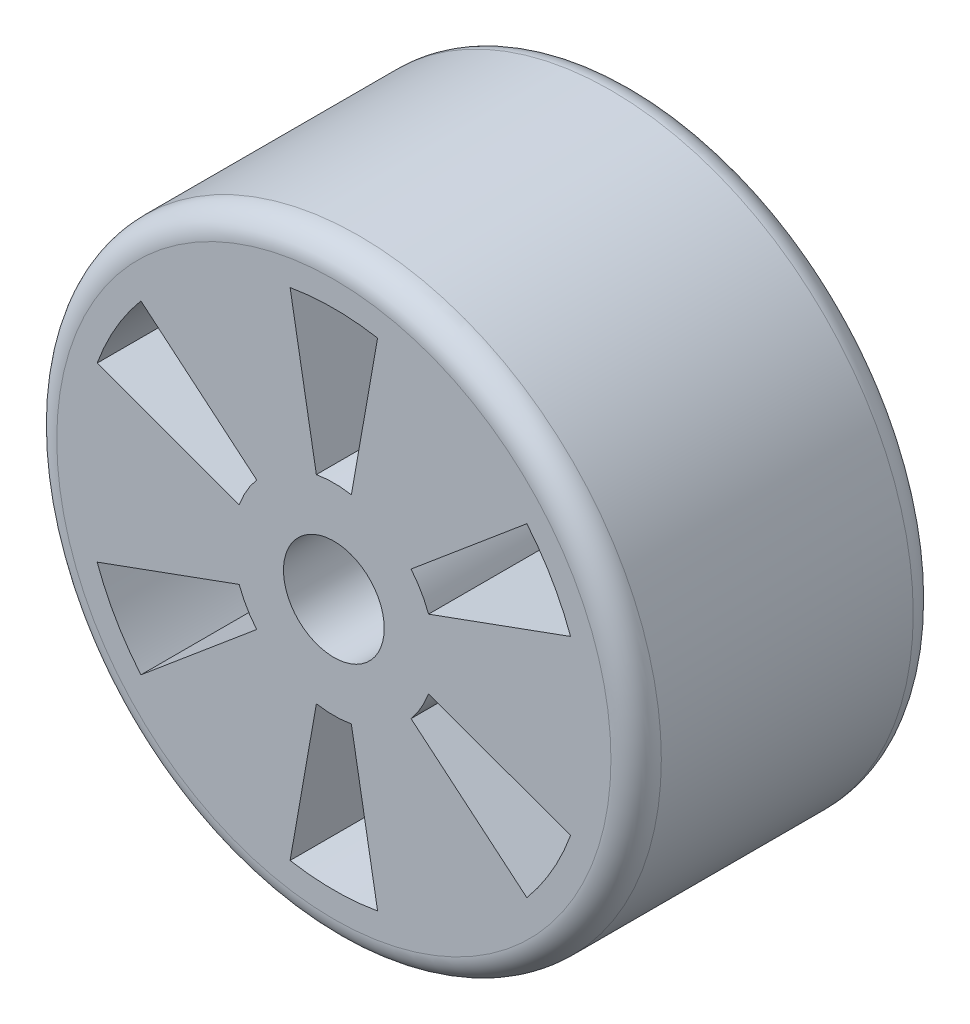
from build123d import *

# Parameters (mm, degrees)
SKETCH_1_R               = 60
SKETCH_1_R_2             = 10
EXTRUDE_1_DEPTH          = 60
CUT_EXTRUDE_1_DEPTH      = 60
PATTERN_CIRCULAR_1_COUNT = 6
FILLET_1_R               = 5


with BuildPart() as part:
    # 草图1 → 凸台-拉伸1 (new body)
    with BuildSketch(Plane.XY):
        Circle(SKETCH_1_R)
        Circle(SKETCH_1_R_2, mode=Mode.SUBTRACT)
    extrude(amount=-EXTRUDE_1_DEPTH)

    # 草图2 → 切除-拉伸1 (cut)
    with BuildSketch(Plane.XY):
        with BuildLine():
            Line((-8.682408883, 49.240387651), (-3.472963553, 19.69615506))
            ThreePointArc((-3.472963553, 19.69615506), (0, 20), (3.472963553, 19.69615506))
            Line((3.472963553, 19.69615506), (8.682408883, 49.240387651))
            ThreePointArc((8.682408883, 49.240387651), (0, 50), (-8.682408883, 49.240387651))
        make_face()
    cut_extrude_1 = extrude(amount=-CUT_EXTRUDE_1_DEPTH, mode=Mode.SUBTRACT)

    # 阵列(圆周)1: 切除-拉伸1 ×6 about axis
    pattern_circular_1_axis = Axis((0, 0, -60), (0, 0, 1))
    for i in range(1, PATTERN_CIRCULAR_1_COUNT):
        add(cut_extrude_1.rotate(pattern_circular_1_axis, i * 360 / PATTERN_CIRCULAR_1_COUNT), mode=Mode.SUBTRACT)

    # 圆角1
    fillet_1_edges = [part.edges().sort_by_distance(p)[0] for p in [
        (-60, 0, -60),
        (-60, 0, 0),
    ]]
    fillet(fillet_1_edges, radius=FILLET_1_R)


solid = part.part
